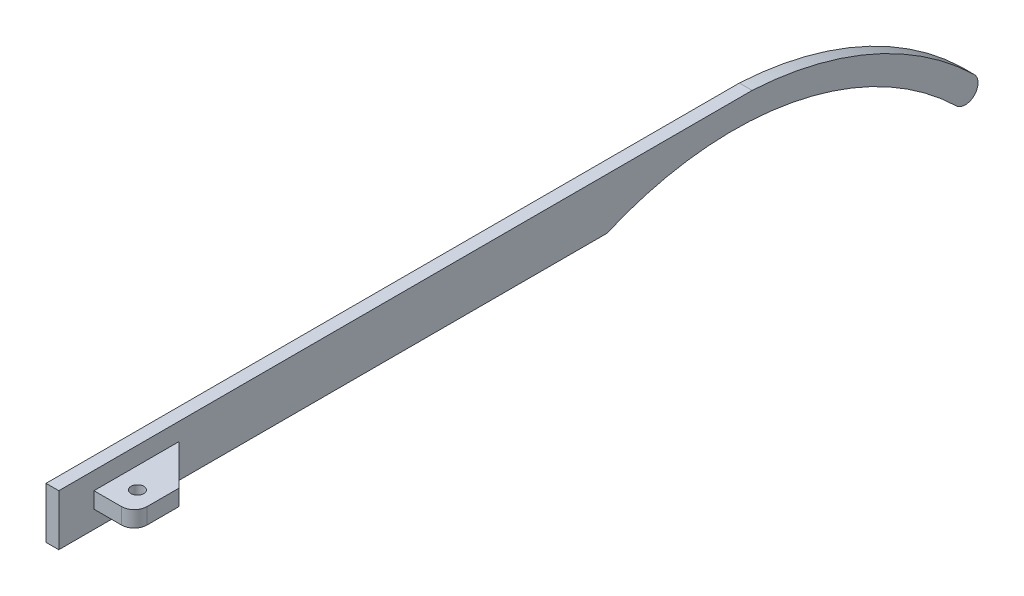
from build123d import *

# Parameters (mm, degrees)
SKETCH1_W           = 140
SKETCH1_H           = 8
BOSS_EXTRUDE1_DEPTH = 2
SKETCH3_W           = 7
SKETCH3_H           = 2.5
BOSS_EXTRUDE2_DEPTH = 6.3
SKETCH4_R           = 1
CUT_EXTRUDE1_DEPTH  = 4
SKETCH6_R           = 50
CUT_EXTRUDE3_DEPTH  = 14
BOSS_EXTRUDE4_DEPTH = 2
CUT_EXTRUDE5_DEPTH  = 2
FILLET6_R           = 2
FILLET7_R           = 2
SKETCH11_W          = 2
SKETCH11_H          = 8
BOSS_EXTRUDE5_DEPTH = 5.5
CHAMFER1_SIZE       = 6.3


with BuildPart() as part:
    # Sketch1 → Boss-Extrude1 (new body)
    with BuildSketch(Plane(origin=(0, 0, 0), x_dir=(0, 0, -1), z_dir=(1, 0, 0))):
        Rectangle(SKETCH1_W, SKETCH1_H)
    extrude(amount=BOSS_EXTRUDE1_DEPTH)

    # Sketch3 → Boss-Extrude2 (add)
    with BuildSketch(Plane(origin=(2, 0, 0), x_dir=(0, 0, -1), z_dir=(1, 0, 0))):
        with Locations((-66.5, 0)):
            Rectangle(SKETCH3_W, SKETCH3_H)
    extrude(amount=BOSS_EXTRUDE2_DEPTH)

    # Sketch4 → Cut-Extrude1 (cut)
    with BuildSketch(Plane(origin=(0, 1.25, 0), x_dir=(1, 0, 0), z_dir=(0, 1, 0))):
        with Locations(Location((5.3, -66.5, 0), (0, 0, 270))):
            Circle(SKETCH4_R)
    extrude(amount=-CUT_EXTRUDE1_DEPTH, mode=Mode.SUBTRACT)

    # Sketch6 → Cut-Extrude3 (cut)
    with BuildSketch(Plane(origin=(2, 0, 0), x_dir=(0, 0, -1), z_dir=(1, 0, 0))):
        with Locations((30, -49.921005204)):
            Circle(SKETCH6_R)
    extrude(amount=-CUT_EXTRUDE3_DEPTH, mode=Mode.SUBTRACT)

    # Sketch9 → Boss-Extrude4 (add)
    with BuildSketch(Plane(origin=(2, 0, 0), x_dir=(0, 0, -1), z_dir=(1, 0, 0))):
        with BuildLine():
            Line((69.093233498, -12.668903321), (66.197438424, -15.428318275))
            ThreePointArc((66.197438424, -15.428318275), (58.566223606, -8.884791089), (49.780325606, -4))
            Line((49.780325606, -4), (58.412343815, -4))
            ThreePointArc((58.412343815, -4), (64.029960524, -7.992950315), (69.093233498, -12.668903321))
        make_face()
    extrude(amount=-BOSS_EXTRUDE4_DEPTH)

    # Sketch10 → Cut-Extrude5 (cut)
    with BuildSketch(Plane(origin=(2, 0, 0), x_dir=(0, 0, -1), z_dir=(1, 0, 0))):
        with BuildLine():
            Line((30, 4.078994796), (98.693138082, 13.357457715))
            Line((98.693138082, 13.357457715), (83.74319787, -55.181108121))
            ThreePointArc((83.74319787, -55.181108121), (70.000284733, -13.644604869), (30, 4.078994796))
        make_face()
    extrude(amount=-CUT_EXTRUDE5_DEPTH, mode=Mode.SUBTRACT)

    # Fillet6
    fillet6_edges = [part.edges().sort_by_distance(p)[0] for p in [
        (1, -15.428318275, -66.197438424),
        (1, -12.668903321, -69.093233498),
    ]]
    fillet(fillet6_edges, radius=FILLET6_R - 0.0001)  # a hair under: the kernel refuses the full size

    # Fillet7
    fillet7_edges = [part.edges().sort_by_distance(p)[0] for p in [
        (8.3, 0, 70),
    ]]
    fillet(fillet7_edges, radius=FILLET7_R)

    # Sketch11 → Boss-Extrude5 (add)
    with BuildSketch(Plane.XY.offset(70)):
        with Locations((1, 0)):
            Rectangle(SKETCH11_W, SKETCH11_H)
    extrude(amount=BOSS_EXTRUDE5_DEPTH)

    # Chamfer1
    chamfer1_edges = [part.edges().sort_by_distance(p)[0] for p in [
        (2, 0, 63),
    ]]
    chamfer(chamfer1_edges, length=CHAMFER1_SIZE - 0.0001)  # a hair under: the kernel refuses the full size


solid = part.part
